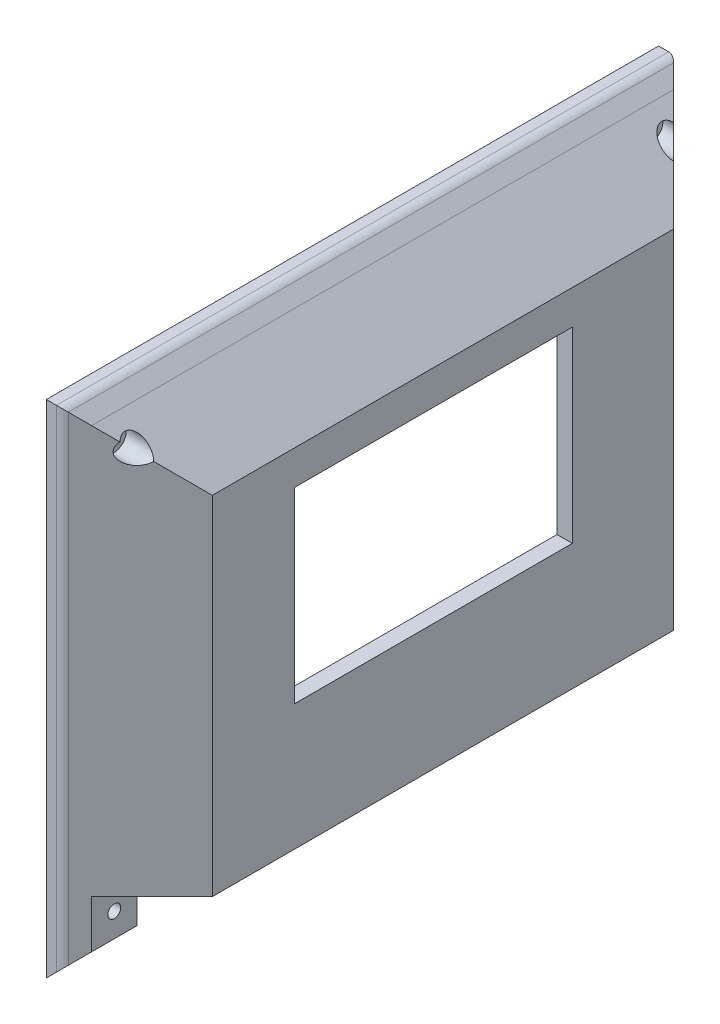
from build123d import *
from build123d.topology import SkipClean

# Parameters (mm, degrees)
BOSS_EXTRUDE1_DEPTH = 6.35
CHAMFER1_SIZE       = 3.175
BOSS_EXTRUDE2_DEPTH = 12.7
CHAMFER2_SIZE       = 12.7
CHAMFER3_SIZE       = 6.35
SKETCH3_W           = 90.7
SKETCH3_H           = 45.44
CUT_EXTRUDE1_DEPTH  = 9.47
BOSS_EXTRUDE3_DEPTH = 24.5
CHAMFER4_SIZE       = 6.35
SKETCH5_R           = 1.35
CUT_EXTRUDE2_DEPTH  = 24.5
FILLET1_R           = 2.5
SKETCH6_W           = 58.4
SKETCH6_H           = 26.5
BOSS_EXTRUDE4_DEPTH = 3.23
SKETCH7_R           = 2.5
CUT_EXTRUDE4_DEPTH  = 12.7
SKETCH8_R           = 1.35
CUT_EXTRUDE5_DEPTH  = 89.292426062


with BuildPart() as part:
    # Sketch1 → Boss-Extrude1 (new body)
    with BuildSketch(Plane(origin=(0, 0, 0), x_dir=(0, 0, -1), z_dir=(1, 0, 0))):
        Polygon((-64.4, -46.35), (-64.4, 59.05), (64.4, 59.05), (64.4, -46.35), (51.7, -46.35), (51.7, 46.35), (-51.7, 46.35), (-51.7, -46.35), align=None)
    extrude(amount=BOSS_EXTRUDE1_DEPTH)

    # Chamfer1
    chamfer1_edges = [part.edges().sort_by_distance(p)[0] for p in [
        (6.35, 6.35, -64.4),
        (6.35, 59.05, 0),
        (6.35, 6.35, 64.4),
    ]]
    chamfer(chamfer1_edges, length=CHAMFER1_SIZE)

    # Sketch2 → Boss-Extrude2 (add)
    with BuildSketch(Plane(origin=(6.35, 0, 0), x_dir=(0, 0, -1), z_dir=(1, 0, 0))):
        Polygon((-51.7, -5.44), (-31.2, -5.44), (-31.2, 35.96), (27.2, 35.96), (27.2, -5.44), (51.7, -5.44), (51.7, 46.35), (-51.7, 46.35), align=None)
        Polygon((-61.225, -5.44), (-51.7, -5.44), (-51.7, 46.35), (51.7, 46.35), (51.7, -5.44), (61.225, -5.44), (61.225, 55.875), (-61.225, 55.875), align=None)
    extrude(amount=BOSS_EXTRUDE2_DEPTH)

    # Chamfer2
    chamfer2_edges = [part.edges().sort_by_distance(p)[0] for p in [
        (19.05, 25.2175, -61.225),
        (19.05, 55.875, 0),
        (19.05, 25.2175, 61.225),
    ]]
    chamfer(chamfer2_edges, length=CHAMFER2_SIZE - 0.0001)  # a hair under: the kernel refuses the full size

    # Chamfer3
    chamfer3_edges = [part.edges().sort_by_distance(p)[0] for p in [
        (6.35, 20.455, -51.7),
        (6.35, 46.35, 0),
        (6.35, 20.455, 51.7),
    ]]
    chamfer(chamfer3_edges, length=CHAMFER3_SIZE - 0.0001)  # a hair under: the kernel refuses the full size

    # Sketch3 → Cut-Extrude1 (cut)
    with BuildSketch(Plane.ZY.offset(-6.35)):
        with Locations((0, 17.28)):
            Rectangle(SKETCH3_W, SKETCH3_H)
    extrude(amount=-CUT_EXTRUDE1_DEPTH, mode=Mode.SUBTRACT)

    # Sketch4 → Boss-Extrude3 (add)
    with SkipClean():  # the faces are left unmerged after this step: merging them gives an invalid solid
        with BuildSketch(Plane.XZ.offset(5.44)):
            Polygon((15.82, -27.2), (15.82, -45.35), (6.35, -45.35), (0, -51.7), (6.35, -51.7), (6.35, -61.225), (19.05, -48.525), (19.05, -27.2), align=None)
            Polygon((0, 51.7), (6.35, 45.35), (15.82, 45.35), (15.82, 31.2), (19.05, 31.2), (19.05, 48.525), (6.35, 61.225), (6.35, 51.7), align=None)
        extrude(amount=BOSS_EXTRUDE3_DEPTH)

    # Chamfer4
    chamfer4_edges = [part.edges().sort_by_distance(p)[0] for p in [
        (6.35, -46.35, -56.4625),
        (6.35, -46.35, 56.4625),
    ]]
    chamfer(chamfer4_edges, length=CHAMFER4_SIZE - 0.0001)  # a hair under: the kernel refuses the full size

    # Sketch5 → Cut-Extrude2 (cut)
    with SkipClean():  # the faces are left unmerged after this step: merging them gives an invalid solid
        with BuildSketch(Plane(origin=(6.35, 0, 0), x_dir=(0, 0, -1), z_dir=(1, 0, 0))):
            with Locations((-56.4625, -34.97)):
                Circle(SKETCH5_R)
            with Locations((56.4625, -34.97)):
                Circle(SKETCH5_R)
        extrude(amount=-CUT_EXTRUDE2_DEPTH, mode=Mode.SUBTRACT)

    # Fillet1
    fillet1_edges = [part.edges().sort_by_distance(p)[0] for p in [
        (3.175, 7.93745, 64.4),
        (3.175, 7.93745, -64.4),
        (3.175, 59.05, 0),
    ]]
    fillet(fillet1_edges, radius=FILLET1_R)

    # Sketch6 → Boss-Extrude4 (add)
    with SkipClean():  # the faces are left unmerged after this step: merging them gives an invalid solid
        with BuildSketch(Plane(origin=(19.05, 0, 0), x_dir=(0, 0, -1), z_dir=(1, 0, 0))):
            with Locations((-2, -16.69)):
                Rectangle(SKETCH6_W, SKETCH6_H)
        extrude(amount=-BOSS_EXTRUDE4_DEPTH)

    # Sketch7 → Cut-Extrude4 (cut)
    with SkipClean():  # the faces are left unmerged after this step: merging them gives an invalid solid
        with BuildSketch(Plane(origin=(19.05, 0, 0), x_dir=(0, 0, -1), z_dir=(1, 0, 0))):
            with Locations(Location((-56.4625, 51.1125, 0), (0, 0, 315))):
                Circle(SKETCH7_R)
            with Locations(Location((56.4625, 51.1125, 0), (0, 0, 45))):
                Circle(SKETCH7_R)
        extrude(amount=-CUT_EXTRUDE4_DEPTH, mode=Mode.SUBTRACT)

    # Sketch8 → Cut-Extrude5 (cut, through all)
    with SkipClean():  # the faces are left unmerged after this step: merging them gives an invalid solid
        with BuildSketch(Plane(origin=(6.35, 0, 0), x_dir=(0, 0, -1), z_dir=(1, 0, 0))):
            with Locations((-56.4625, 51.1125)):
                Circle(SKETCH8_R)
            with Locations((56.4625, 51.1125)):
                Circle(SKETCH8_R)
        extrude(amount=-CUT_EXTRUDE5_DEPTH, mode=Mode.SUBTRACT)


solid = part.part
